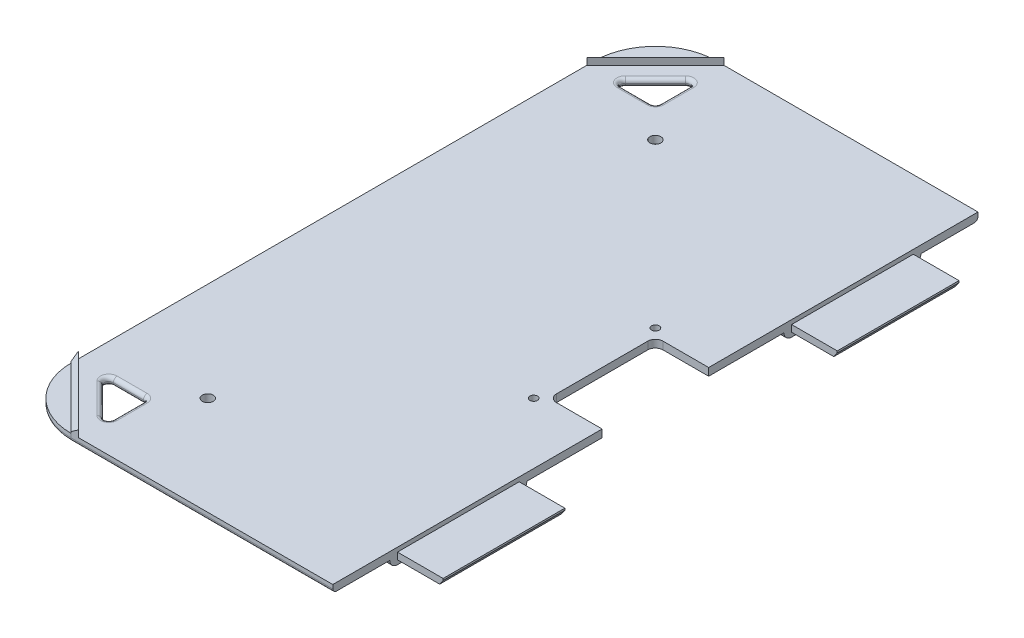
from build123d import *
from OCP.BRepFilletAPI import BRepFilletAPI_MakeChamfer

# Parameters (mm, degrees)
SKETCH1_W           = 134.62
SKETCH1_H           = 269.24
BOSS_EXTRUDE1_DEPTH = 3.175
BOSS_EXTRUDE2_DEPTH = 3.175
CUT_EXTRUDE1_REACH  = 192.408
SKETCH2_3_R         = 2.286
CHAMFER1_SIZE       = 2.54
FILLET1_R           = 1.905
FILLET2_R           = 1.5875
FILLET3_R           = 25.4
FILLET4_R           = 1.5875
SKETCH3_W           = 31.75
SKETCH3_H           = 57.15
BOSS_EXTRUDE3_DEPTH = 3.175
SKETCH4_W           = 50.8
SKETCH4_H           = 2.794
BOSS_EXTRUDE4_DEPTH = 19.05
FILLET5_R           = 12.7
FILLET6_R           = 3.175
CUT_EXTRUDE2_REACH  = 192.478
SKETCH5_W           = 22.225
SKETCH5_H           = 44.45
SKETCH5_R           = 1.5875
FILLET7_R           = 3.175
CHAMFER2_SIZE       = 2.032
CHAMFER2_SIZE2      = 1.422821718


# Some blends are built 0.0001 mm under size
with BuildPart() as part:
    # Sketch1 → Boss-Extrude1 (new body)
    with BuildSketch(Plane(origin=(0, 0, 0), x_dir=(1, 0, 0), z_dir=(0, 1, 0))):
        with Locations((-67.31, 0)):
            Rectangle(SKETCH1_W, SKETCH1_H)
    extrude(amount=BOSS_EXTRUDE1_DEPTH)

    # Sketch2 → Boss-Extrude2 (add)
    with BuildSketch(Plane(origin=(0, 3.175, 0), x_dir=(1, 0, 0), z_dir=(0, 1, 0))):
        Polygon((-134.62, 109.22), (-134.62, 106.045), (-120.3325, 120.3325), (-106.045, 134.62), (-109.22, 134.62), align=None)
        Polygon((-134.62, -109.22), (-109.22, -134.62), (-106.045, -134.62), (-120.3325, -120.3325), (-134.62, -106.045), align=None)
    extrude(amount=BOSS_EXTRUDE2_DEPTH)

    # Sketch2<3> → Cut-Extrude1 (cut, up to next)
    with BuildSketch(Plane(origin=(0, 3.175, 0), x_dir=(1, 0, 0), z_dir=(0, 1, 0)), mode=Mode.PRIVATE) as cut_extrude1_sk1:
        with Locations(Location((-93.391731637, 93.391731637, 0), (0, 0, 270))):
            Circle(SKETCH2_3_R)
    cut_extrude1_tool1 = extrude(cut_extrude1_sk1.sketch, amount=-CUT_EXTRUDE1_REACH, mode=Mode.PRIVATE) & part.part
    # Sketch2<3> → Cut-Extrude1 (cut, up to next)
    with BuildSketch(Plane(origin=(0, 3.175, 0), x_dir=(1, 0, 0), z_dir=(0, 1, 0)), mode=Mode.PRIVATE) as cut_extrude1_sk2:
        with Locations(Location((-93.391731637, -93.391731637, 0), (0, 0, 270))):
            Circle(SKETCH2_3_R)
    cut_extrude1_tool2 = extrude(cut_extrude1_sk2.sketch, amount=-CUT_EXTRUDE1_REACH, mode=Mode.PRIVATE) & part.part
    # Sketch2<3> → Cut-Extrude1 (cut, up to next)
    with BuildSketch(Plane(origin=(0, 3.175, 0), x_dir=(1, 0, 0), z_dir=(0, 1, 0)), mode=Mode.PRIVATE) as cut_extrude1_sk3:
        Polygon((-124.918359133, -105.868359133), (-105.868359133, -124.918359133), (-105.868359133, -105.868359133), align=None)
    cut_extrude1_tool3 = extrude(cut_extrude1_sk3.sketch, amount=-CUT_EXTRUDE1_REACH, mode=Mode.PRIVATE) & part.part
    # Sketch2<3> → Cut-Extrude1 (cut, up to next)
    with BuildSketch(Plane(origin=(0, 3.175, 0), x_dir=(1, 0, 0), z_dir=(0, 1, 0)), mode=Mode.PRIVATE) as cut_extrude1_sk4:
        Polygon((-124.918359133, 105.868359133), (-105.868359133, 124.918359133), (-105.868359133, 105.868359133), align=None)
    cut_extrude1_tool4 = extrude(cut_extrude1_sk4.sketch, amount=-CUT_EXTRUDE1_REACH, mode=Mode.PRIVATE) & part.part
    add(cut_extrude1_tool1.solids().sort_by_distance((-93.391732, 3.175, -93.391732))[0], mode=Mode.SUBTRACT)
    add(cut_extrude1_tool2.solids().sort_by_distance((-93.391732, 3.175, 93.391732))[0], mode=Mode.SUBTRACT)
    add(cut_extrude1_tool3.solids().sort_by_distance((-112.218359, 3.175, 112.218359))[0], mode=Mode.SUBTRACT)
    add(cut_extrude1_tool4.solids().sort_by_distance((-112.218359, 3.175, -112.218359))[0], mode=Mode.SUBTRACT)

    # Chamfer1
    # the kernel refuses this chamfer: 2.54 mm, written as the material it takes off along each edge
    with BuildSketch(Plane(origin=(-104.601125621, 6.35, -139.238874379), x_dir=(0.7068394360706735, 0.027495876610586185, 0.7068394360706735), z_dir=(-0.7071067811865476, 0, 0.7071067811865476))) as chamfer1_piece_1:
        Polygon((CHAMFER1_SIZE * 0.999621916911, -CHAMFER1_SIZE * 0.0274958766106), (-CHAMFER1_SIZE * 0.0274958766106, -CHAMFER1_SIZE * 0.999621916911), (0, 0), align=None)
    extrude(amount=48.985174063, mode=Mode.SUBTRACT)
    with BuildSketch(Plane(origin=(-139.238874379, 6.35, 104.601125621), x_dir=(-0.019442520806012394, -0.9996219169112968, 0.019442520806012414), z_dir=(0.7071067811865479, 0, 0.7071067811865471))) as chamfer1_piece_2:
        Polygon((CHAMFER1_SIZE * 0.999621916911, CHAMFER1_SIZE * 0.0274958766106), (-CHAMFER1_SIZE * 0.0274958766106, CHAMFER1_SIZE * 0.999621916911), (0, 0), align=None)
    extrude(amount=48.985174063, mode=Mode.SUBTRACT)

    # Fillet1
    fillet1_edges = [part.edges().sort_by_distance(p)[0] for p in [
        (-105.868359133, 1.5875, -124.918359133),
        (-105.868359133, 1.5875, -105.868359133),
        (-124.918359133, 1.5875, -105.868359133),
        (-105.868359133, 1.5875, 124.918359133),
        (-124.918359133, 1.5875, 105.868359133),
        (-105.868359133, 1.5875, 105.868359133),
    ]]
    fillet(fillet1_edges, radius=FILLET1_R)

    # Fillet2
    fillet2_edges = [part.edges().sort_by_distance(p)[0] for p in [
        (-107.044347195, 0, 122.079272807),
        (-105.868359133, 0, 114.046320715),
        (-106.426320715, 0, 106.426320715),
        (-114.046320715, 0, 105.868359133),
        (-122.079272807, 0, 107.044347195),
        (-122.079272807, 3.175, 107.044347195),
        (-114.046320715, 3.175, 105.868359133),
        (-106.426320715, 3.175, 106.426320715),
        (-105.868359133, 3.175, 114.046320715),
        (-107.044347195, 3.175, 122.079272807),
        (-122.079272807, 3.175, -107.044347195),
        (-114.046320715, 3.175, -105.868359133),
        (-106.426320715, 3.175, -106.426320715),
        (-105.868359133, 3.175, -114.046320715),
        (-107.044347195, 3.175, -122.079272807),
        (-107.044347195, 0, -122.079272807),
        (-105.868359133, 0, -114.046320715),
        (-106.426320715, 0, -106.426320715),
        (-114.046320715, 0, -105.868359133),
        (-122.079272807, 0, -107.044347195),
        (-115.393359133, 0, 115.393359133),
        (-115.393359133, 3.175, 115.393359133),
        (-115.393359133, 3.175, -115.393359133),
        (-115.393359133, 0, -115.393359133),
    ]]
    fillet(fillet2_edges, radius=FILLET2_R - 0.0001)  # a hair under: the kernel refuses the full size

    # Fillet3
    fillet3_edges = [part.edges().sort_by_distance(p)[0] for p in [
        (-134.62, 1.5875, 134.62),
        (-134.62, 1.5875, -134.62),
    ]]
    fillet(fillet3_edges, radius=FILLET3_R)

    # Fillet4
    fillet4_edges = [part.edges().sort_by_distance(p)[0] for p in [
        (-54.61, 0, 134.62),
        (-54.61, 0, -134.62),
        (-134.62, 0, 0),
        (-127.180512242, 0, -127.180512242),
        (-127.180512242, 0, 127.180512242),
    ]]
    fillet(fillet4_edges, radius=FILLET4_R)

    # Sketch3 → Boss-Extrude3 (add)
    with BuildSketch(Plane.XZ):
        with Locations((-15.875, 82.2325)):
            Rectangle(SKETCH3_W, SKETCH3_H)
        with Locations((-15.875, -82.2325)):
            Rectangle(SKETCH3_W, SKETCH3_H)
    extrude(amount=BOSS_EXTRUDE3_DEPTH)

    # Sketch4 → Boss-Extrude4 (add)
    with BuildSketch(Plane(origin=(0, 0, 0), x_dir=(0, 0, -1), z_dir=(1, 0, 0))):
        with Locations((-82.2325, 0)):
            Rectangle(SKETCH4_W, SKETCH4_H)
        with Locations((82.2325, 0)):
            Rectangle(SKETCH4_W, SKETCH4_H)
    extrude(amount=BOSS_EXTRUDE4_DEPTH)

    # Fillet5
    fillet5_edges = [part.edges().sort_by_distance(p)[0] for p in [
        (-31.75, -1.5875, 110.8075),
        (-31.75, -1.5875, 53.6575),
        (-31.75, -1.5875, -53.6575),
        (-31.75, -1.5875, -110.8075),
    ]]
    fillet(fillet5_edges, radius=FILLET5_R)

    # Fillet6
    fillet6_edges = [part.edges().sort_by_distance(p)[0] for p in [
        (-9.525, -3.175, -53.6575),
        (-28.030256121, -3.175, -57.377243879),
        (-31.75, -3.175, -82.2325),
        (-28.030256121, -3.175, -107.087756121),
        (-9.525, -3.175, 110.8075),
        (-28.030256121, -3.175, 107.087756121),
        (-31.75, -3.175, 82.2325),
        (-28.030256121, -3.175, 57.377243879),
        (-9.525, -3.175, -110.8075),
        (-9.525, -3.175, 53.6575),
    ]]
    fillet(fillet6_edges, radius=FILLET6_R - 0.0001)  # a hair under: the kernel refuses the full size

    # Sketch5 → Cut-Extrude2 (cut, up to next)
    with BuildSketch(Plane.XZ, mode=Mode.PRIVATE) as cut_extrude2_sk1:
        with Locations((-11.1125, 0)):
            Rectangle(SKETCH5_W, SKETCH5_H)
    cut_extrude2_tool1 = extrude(cut_extrude2_sk1.sketch, amount=-CUT_EXTRUDE2_REACH, mode=Mode.PRIVATE) & part.part
    # Sketch5 → Cut-Extrude2 (cut, up to next)
    with BuildSketch(Plane.XZ, mode=Mode.PRIVATE) as cut_extrude2_sk2:
        with Locations(Location((-25.4, 25.4, 0), (0, 0, 270))):
            Circle(SKETCH5_R)
    cut_extrude2_tool2 = extrude(cut_extrude2_sk2.sketch, amount=-CUT_EXTRUDE2_REACH, mode=Mode.PRIVATE) & part.part
    # Sketch5 → Cut-Extrude2 (cut, up to next)
    with BuildSketch(Plane.XZ, mode=Mode.PRIVATE) as cut_extrude2_sk3:
        with Locations(Location((-25.4, -25.4, 0), (0, 0, 270))):
            Circle(SKETCH5_R)
    cut_extrude2_tool3 = extrude(cut_extrude2_sk3.sketch, amount=-CUT_EXTRUDE2_REACH, mode=Mode.PRIVATE) & part.part
    add(cut_extrude2_tool1.solids().sort_by_distance((-11.1125, 0, 0))[0], mode=Mode.SUBTRACT)
    add(cut_extrude2_tool2.solids().sort_by_distance((-25.4, 0, 25.4))[0], mode=Mode.SUBTRACT)
    add(cut_extrude2_tool3.solids().sort_by_distance((-25.4, 0, -25.4))[0], mode=Mode.SUBTRACT)

    # Fillet7
    fillet7_edges = [part.edges().sort_by_distance(p)[0] for p in [
        (-22.225, 1.5875, 22.225),
        (-22.225, 1.5875, -22.225),
    ]]
    fillet(fillet7_edges, radius=FILLET7_R)

    # Chamfer2: one chamfer whose edges measure the first distance from different faces: ONE call of the kernel's chamfer builder (chamfer() names one face for all edges)
    chamfer2_edges_1 = [part.edges().sort_by_distance(p)[0] for p in [
        (19.05, -1.397, 82.2325),
    ]]
    chamfer2_side_1 = [part.faces().sort_by_distance(p)[0] for p in [
        (19.05, 0, 82.2325),
    ]]
    chamfer2_edges_2 = [part.edges().sort_by_distance(p)[0] for p in [
        (19.05, -1.397, -82.2325),
    ]]
    chamfer2_side_2 = [part.faces().sort_by_distance(p)[0] for p in [
        (19.05, 0, -82.2325),
    ]]
    chamfer2 = BRepFilletAPI_MakeChamfer(part.part.solid().wrapped)
    for e in chamfer2_edges_1:
        chamfer2.Add(CHAMFER2_SIZE, CHAMFER2_SIZE2, e.wrapped, chamfer2_side_1[0].wrapped)  # the first distance lies on this face
    for e in chamfer2_edges_2:
        chamfer2.Add(CHAMFER2_SIZE, CHAMFER2_SIZE2, e.wrapped, chamfer2_side_2[0].wrapped)  # the first distance lies on this face
    add(Compound.cast(chamfer2.Shape()), mode=Mode.REPLACE)


solid = part.part
